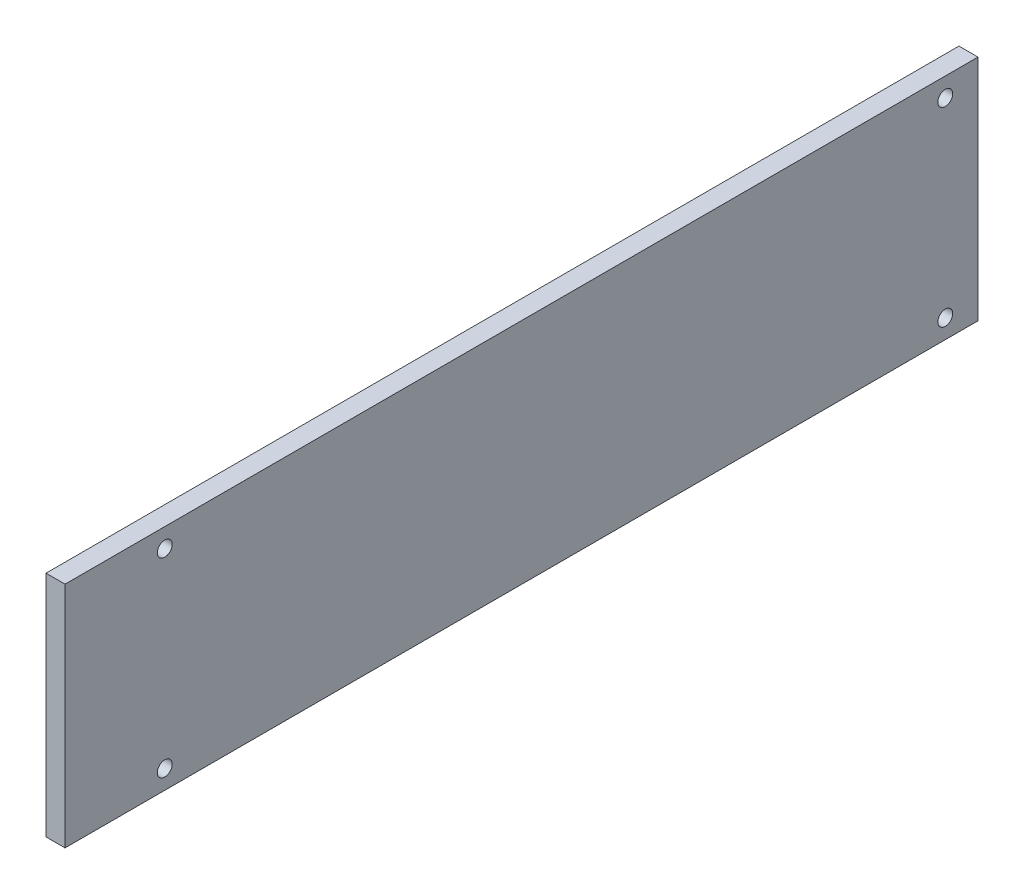
from build123d import *

# Parameters (mm, degrees)
SKETCH1_W              = 304.546
SKETCH1_H              = 76.2
BOSS_EXTRUDE1_DEPTH    = 6.35
F_10_CLEARANCE_HOLE1_D = 4.9784


with BuildPart() as part:
    # Sketch1 → Boss-Extrude1 (new body)
    with BuildSketch(Plane(origin=(0, 0, 0), x_dir=(0, 0, -1), z_dir=(1, 0, 0))):
        Rectangle(SKETCH1_W, SKETCH1_H)
    extrude(amount=BOSS_EXTRUDE1_DEPTH)

    # #10 Clearance Hole1 (through all)
    with Locations(Plane(origin=(6.35, 0, 0), x_dir=(0, 0, -1), z_dir=(1, 0, 0))):
        with Locations((-118.999, 31.75), (-118.999, -31.75), (141.351, -31.75), (141.351, 31.75)):
            Hole(F_10_CLEARANCE_HOLE1_D / 2)


solid = part.part
